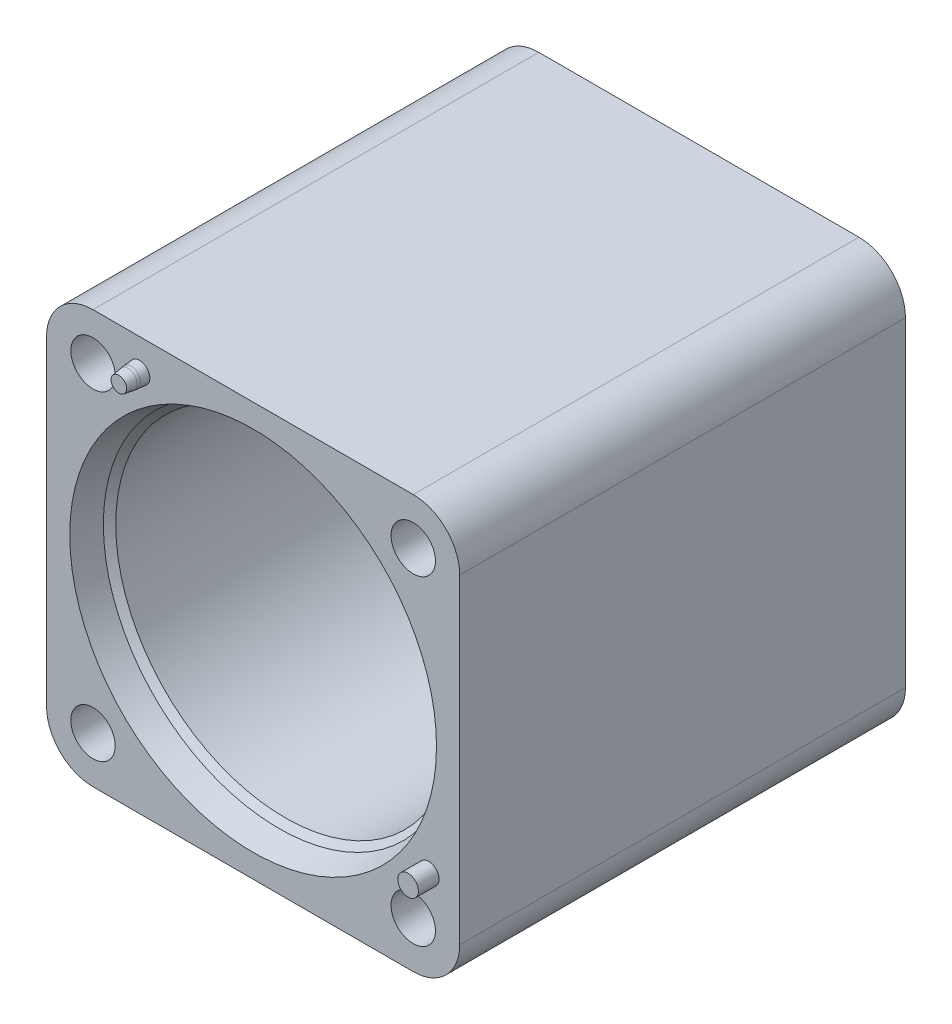
from build123d import *

# Parameters (mm, degrees)
SKETCH1_R           = 16.4
SKETCH1_R_2         = 2.15
BOSS_EXTRUDE1_DEPTH = 43.15
SKETCH6_R           = 1
BOSS_EXTRUDE2_DEPTH = 2


with BuildPart() as part:
    # Sketch1 → Boss-Extrude1 (new body)
    with BuildSketch(Plane.XY):
        with BuildLine():
            Line((-15.5, -20), (15.5, -20))
            ThreePointArc((15.5, -20), (18.681980515, -18.681980515), (20, -15.5))
            Line((20, -15.5), (20, 15.5))
            ThreePointArc((20, 15.5), (18.681980515, 18.681980515), (15.5, 20))
            Line((15.5, 20), (-15.5, 20))
            ThreePointArc((-15.5, 20), (-18.681980515, 18.681980515), (-20, 15.5))
            Line((-20, 15.5), (-20, -15.5))
            ThreePointArc((-20, -15.5), (-18.681980515, -18.681980515), (-15.5, -20))
        make_face()
        Circle(SKETCH1_R, mode=Mode.SUBTRACT)
        with Locations((-15.5, 15.5)):
            Circle(SKETCH1_R_2, mode=Mode.SUBTRACT)
        with Locations((15.5, 15.5)):
            Circle(SKETCH1_R_2, mode=Mode.SUBTRACT)
        with Locations((15.5, -15.5)):
            Circle(SKETCH1_R_2, mode=Mode.SUBTRACT)
        with Locations((-15.5, -15.5)):
            Circle(SKETCH1_R_2, mode=Mode.SUBTRACT)
    extrude(amount=BOSS_EXTRUDE1_DEPTH)

    # Sketch5 → Cut-Revolve1 (revolve, cut)
    with BuildSketch(Plane(origin=(0, 0, 0), x_dir=(1, 0, 0), z_dir=(0, 1, 0))):
        Polygon((16.4, -3.1), (17, -2.5), (17.75, 0), (16.4, 0), align=None)
    cut_revolve1 = revolve(axis=Axis((0, 0, -2.15), (0, 0, 1)), mode=Mode.SUBTRACT)

    # Mirror1: Cut-Revolve1 across plane
    add(cut_revolve1.mirror(Plane(origin=(0, 0, 21.575), x_dir=(1, 0, 0), z_dir=(0, 0, -1))), mode=Mode.SUBTRACT)

    # Sketch6 → Boss-Extrude2 (add)
    with BuildSketch(Plane.XY.offset(43.15)):
        with Locations((-11, 17)):
            Circle(SKETCH6_R)
        with Locations((17, -11)):
            Circle(SKETCH6_R)
    extrude(amount=BOSS_EXTRUDE2_DEPTH)

    # Sketch8 → Cut-Revolve2 (revolve, cut)
    with BuildSketch(Plane(origin=(0, 17, 0), x_dir=(1, 0, 0), z_dir=(0, 1, 0))):
        with BuildLine():
            Line((-10.074767306, -43.956456277), (-10, -43.15))
            Line((-10, -43.15), (-10, -45.15))
            Line((-10, -45.15), (-10.25, -45.15))
            Line((-10.25, -45.15), (-10.112204786, -44.259358861))
            ThreePointArc((-10.112204786, -44.259358861), (-10.091174305, -44.10819329), (-10.074767306, -43.956456277))
        make_face()
    revolve(axis=Axis((-11, 17, 45.15), (0, 0, -1)), mode=Mode.SUBTRACT)


solid = part.part
